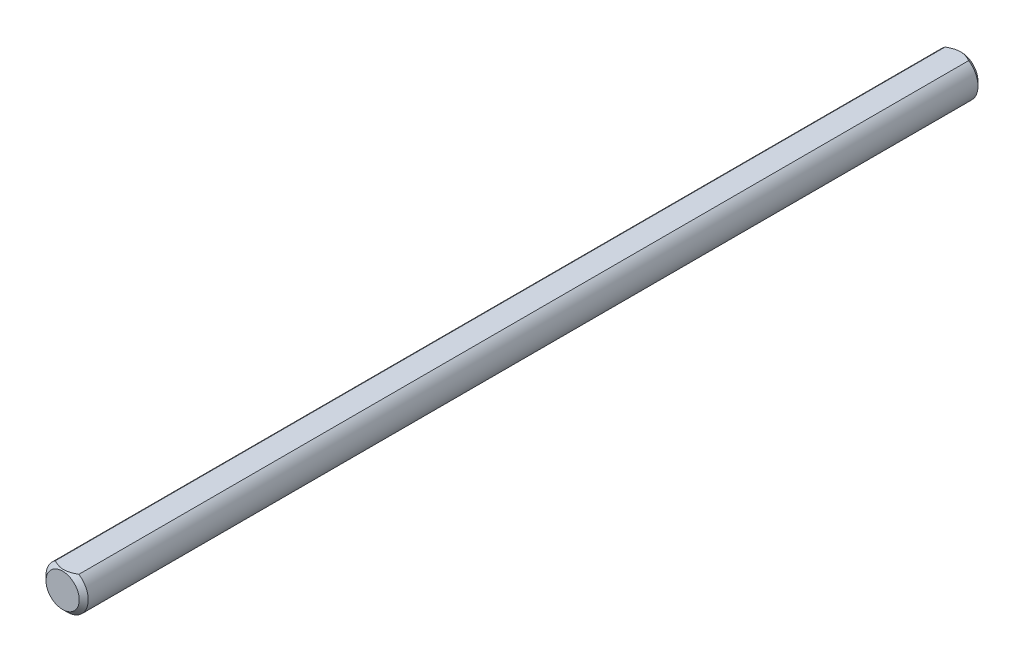
from build123d import *

# Parameters (mm, degrees)
BOSS_EXTRUDE1_DEPTH = 100


with BuildPart() as part:
    # Sketch1 → Boss-Extrude1 (new body)
    with BuildSketch(Plane.XY):
        with BuildLine():
            Line((-1.311487705, 1.95), (1.311487705, 1.95))
            ThreePointArc((1.311487705, 1.95), (0, -2.35), (-1.311487705, 1.95))
        make_face()
    extrude(amount=BOSS_EXTRUDE1_DEPTH)

    # Chamfer1: read off the stored shape, not the designer's step
    # Chamfer1 outline → Chamfer1 (revolve, cut)
    with BuildSketch(Plane.XZ):
        Polygon((2.35, 0.5), (1.85, 0), (2.35, 0), align=None)
        Polygon((1.85, 100), (2.35, 99.5), (2.35, 100), align=None)
    revolve(axis=Axis((0, 0, 0), (0, 0, 1)), mode=Mode.SUBTRACT)


solid = part.part
